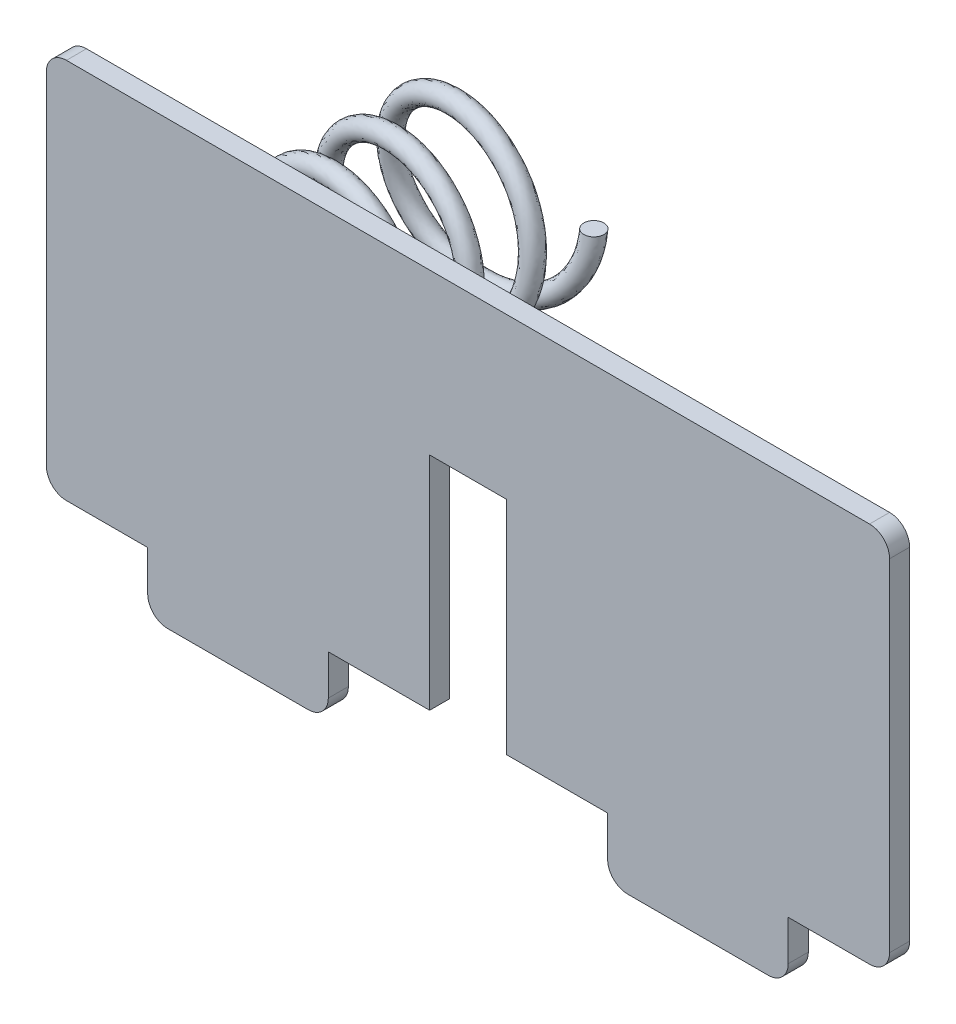
from build123d import *

# Parameters (mm, degrees)
SKETCH1_R           = 1.264257111
BOSS_EXTRUDE1_DEPTH = 0.5
SKETCH1_3_R         = 1.264257111
BOSS_EXTRUDE2_DEPTH = 0.5
CHAMFER1_SIZE       = 0.5
SWEEP1_PITCH        = 1.54305
FILLET1_R           = 0.5


with BuildPart() as part:
    # Sketch1 → Boss-Extrude1 (new body)
    # profile 1 of 3: a face of its own
    with BuildSketch(Plane.XY):
        Polygon((0, -9.5), (0, 0), (21.01, 0), (21.01, -9.5), (18.485, -9.5), (18.485, -11), (13.985, -11), (13.985, -9.5), (11.46, -9.5), (11.46, -3.99), (9.55, -3.99), (9.55, -9.5), (7.025, -9.5), (7.025, -11), (2.525, -11), (2.525, -9.5), align=None)
        with Locations((16.241368736, -3.511282068)):
            Circle(SKETCH1_R, mode=Mode.SUBTRACT)
        with Locations((4.775, -3.51)):
            Circle(SKETCH1_R, mode=Mode.SUBTRACT)
    # profile 2 of 3: a face of its own
    with BuildSketch(Plane.XY):
        with Locations((4.775, -3.51)):
            Circle(SKETCH1_R)
    # profile 3 of 3: a face of its own
    with BuildSketch(Plane.XY):
        with Locations((16.241368736, -3.511282068)):
            Circle(SKETCH1_R)
    extrude(amount=BOSS_EXTRUDE1_DEPTH)

    # Sketch1<3> → Boss-Extrude2 (add)
    with BuildSketch(Plane.XY):
        with Locations((16.241368736, -3.511282068)):
            Circle(SKETCH1_3_R)
        with Locations((4.775, -3.51)):
            Circle(SKETCH1_3_R)
    extrude(amount=-BOSS_EXTRUDE2_DEPTH)

    # Chamfer1
    chamfer1_edges = [part.edges().sort_by_distance(p)[0] for p in [
        (14.977111625, -3.511282068, 0),
        (3.510742889, -3.51, 0),
    ]]
    chamfer(chamfer1_edges, length=CHAMFER1_SIZE - 0.0001)  # a hair under: the kernel refuses the full size

    # Sweep1: the profile of Sketch3 screwed along a left-hand helix of 4 turns, 8 arcs to a turn; built about Z, then put on its axis
    sweep1_z = Axis((0, 0, 0), (0, 0, 1))
    sweep1_corners = [(1.887194579, 0, 0), (2.137194579, 0, 0.25), (2.387194579, 0, 0), (2.137194579, 0, -0.25)]
    with BuildLine(mode=Mode.PRIVATE) as sweep1_profile:
        ThreePointArc((1.887194579, 0, 0), (1.960417884, 0, 0.176776695), (2.137194579, 0, 0.25))
        ThreePointArc((2.137194579, 0, 0.25), (2.313971274, 0, 0.176776695), (2.387194579, 0, 0))
        ThreePointArc((2.387194579, 0, 0), (2.313971274, 0, -0.176776695), (2.137194579, 0, -0.25))
        ThreePointArc((2.137194579, 0, -0.25), (1.960417884, 0, -0.176776695), (1.887194579, 0, 0))
    sweep1_cap = Face(sweep1_profile.wire())
    sweep1_arcs = [((1.887194579, 0, 0), (1.887194579, 0, 0.25), (2.137194579, 0, 0.25), (1, 0.7071067811865476, 1)), ((2.137194579, 0, 0.25), (2.387194579, 0, 0.25), (2.387194579, 0, 0), (1, 0.7071067811865476, 1)), ((2.387194579, 0, 0), (2.387194579, 0, -0.25), (2.137194579, 0, -0.25), (1, 0.7071067811865476, 1)), ((2.137194579, 0, -0.25), (1.887194579, 0, -0.25), (1.887194579, 0, 0), (1, 0.7071067811865476, 1))]  # start, shoulder, end, weights
    sweep1_turn_angles = [0, -22.5, -45, -67.5, -90, -112.5, -135, -157.5, -180, -202.5, -225, -247.5, -270, -292.5, -315, -337.5, -360]
    sweep1_turn_weights = [1, 0.9238795325112867, 1, 0.9238795325112867, 1, 0.9238795325112867, 1, 0.9238795325112867, 1, 0.9238795325112867, 1, 0.9238795325112867, 1, 0.9238795325112867, 1, 0.9238795325112867, 1]
    sweep1_turn_sides = [Face.make_bezier_surface([[Vector(p[j][0], p[j][1], 0).rotate(sweep1_z, sweep1_turn_angles[2 * i + k]) / sweep1_turn_weights[2 * i + k] + Vector(0, 0, p[j][2] + -SWEEP1_PITCH * sweep1_turn_angles[2 * i + k] / 360) for k in range(3)] for j in range(3)], [[p[3][j] * sweep1_turn_weights[2 * i + k] for k in range(3)] for j in range(3)]) for p in sweep1_arcs for i in range(8)]
    sweep1 = Plane(origin=(4.831904448, -3.735293954, 0), x_dir=(1, 0, 0), z_dir=(0, 0, -1)) * Solid(Shell([*[p.moved(Location((0, 0, SWEEP1_PITCH * i))) for i in range(4) for p in sweep1_turn_sides], sweep1_cap, sweep1_cap.rotate(sweep1_z, -1440).moved(Location((0, 0, -SWEEP1_PITCH * -1440 / 360)))]))
    add(sweep1)

    # Fillet1
    fillet1_edges = [part.edges().sort_by_distance(p)[0] for p in [
        (0, 0, 0.25),
        (21.01, 0, 0.25),
        (21.01, -9.5, 0.25),
        (18.485, -11, 0.25),
        (13.985, -11, 0.25),
        (7.025, -11, 0.25),
        (2.525, -11, 0.25),
        (0, -9.5, 0.25),
    ]]
    fillet(fillet1_edges, radius=FILLET1_R)


solid = part.part
